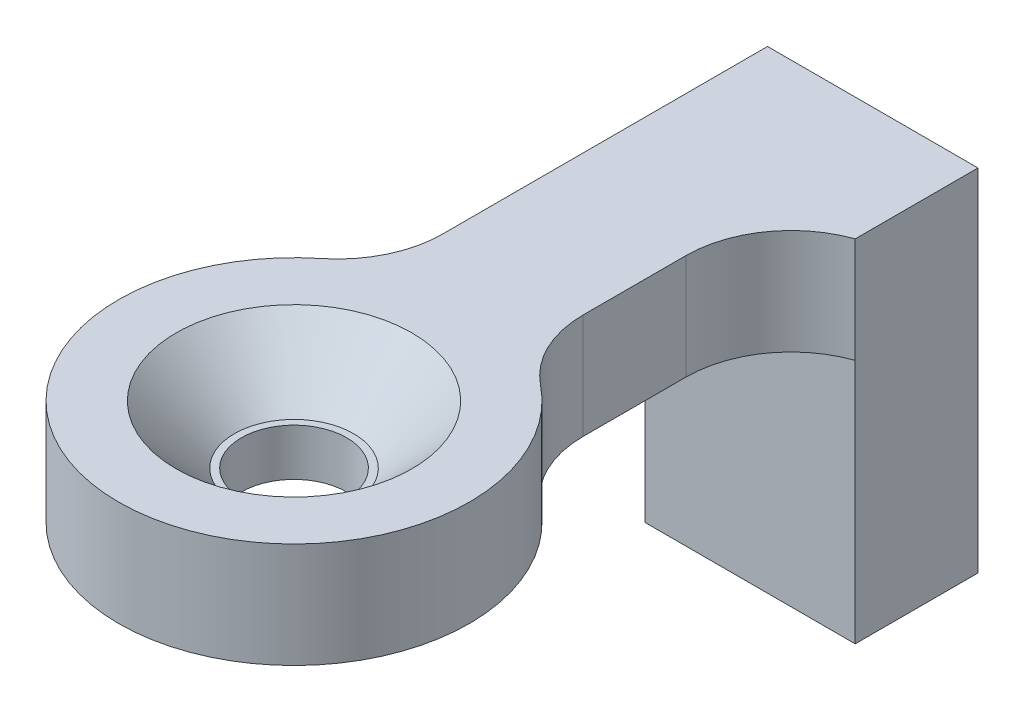
from build123d import *

# Parameters (mm, degrees)
CROQUIS1_W              = 4
CROQUIS1_H              = 14
CROQUIS1_R              = 1.5
SALIENTE_EXTRUIR1_DEPTH = 3
CROQUIS2_W              = 6
CROQUIS2_H              = 3.5
SALIENTE_EXTRUIR2_DEPTH = 10
SALIENTE_EXTRUIR3_START = -3
CROQUIS3_R              = 5
CROQUIS3_R_2            = 1.5
SALIENTE_EXTRUIR3_DEPTH = 3
REDONDEO1_R             = 3


# Read off the part's stored shape, not the designer's step: TaladroAvanzado1
with BuildPart() as part:
    # Croquis1 → Saliente-Extruir1 (new body)
    with BuildSketch(Plane(origin=(0, 0, 0), x_dir=(1, 0, 0), z_dir=(0, 1, 0))):
        with Locations((2, 7)):
            Rectangle(CROQUIS1_W, CROQUIS1_H)
        with Locations(Location((2, 2, 0), (0, 0, 270))):
            Circle(CROQUIS1_R, mode=Mode.SUBTRACT)
    extrude(amount=SALIENTE_EXTRUIR1_DEPTH)

    # Croquis2 → Saliente-Extruir2 (add)
    with BuildSketch(Plane(origin=(0, 3, 0), x_dir=(1, 0, 0), z_dir=(0, 1, 0))):
        with Locations((3, 15.75)):
            Rectangle(CROQUIS2_W, CROQUIS2_H)
    extrude(amount=-SALIENTE_EXTRUIR2_DEPTH)

    # Croquis3 → Saliente-Extruir3 (add)
    with BuildSketch(Plane(origin=(0, 3, 0), x_dir=(1, 0, 0), z_dir=(0, 1, 0)).offset(SALIENTE_EXTRUIR3_START)):
        with Locations((2, 2)):
            Circle(CROQUIS3_R)
        with Locations(Location((2, 2, 0), (0, 0, 270))):
            Circle(CROQUIS3_R_2, mode=Mode.SUBTRACT)
    extrude(amount=SALIENTE_EXTRUIR3_DEPTH)

    # TaladroAvanzado1 outline → TaladroAvanzado1 (revolve, cut)
    with BuildSketch(Plane(origin=(2, 0, -2), x_dir=(1, 0, 0), z_dir=(0, 0, 1))):
        Polygon((1.5, 1.34), (1.7, 1.34), (3.36, 3), (1.5, 3), align=None)
    revolve(axis=Axis((2, 0, -2), (0, 1, 0)), mode=Mode.SUBTRACT)

    # Redondeo1
    # the kernel refuses this fillet: 3 mm, written as the material it adds along each edge
    with BuildSketch(Plane(origin=(4, 0, -14), x_dir=(1, 0, 0), z_dir=(0, 1, 0))) as redondeo1_piece_1:
        with BuildLine():
            CenterArc((3, -2.828427125), REDONDEO1_R, 109.471220634, 70.528779366)
            Line((0, -2.828427125), (-0.06, -2.828427125))
            Line((-0.06, -2.828427125), (-0.06, 0))
            Line((-0.06, 0), (0, 0.06))
            ThreePointArc((0, 0.06), (1, 0.06), (1.98, 0.056568542))
            Line((1.98, 0.056568542), (2, 0))
        make_face()
    extrude(amount=3)
    with BuildSketch(Plane(origin=(4, 3, -6.582575695), x_dir=(0, 0, -1), z_dir=(0, -1, 0))) as redondeo1_piece_2:
        with BuildLine():
            CenterArc((1.662422303, 3), REDONDEO1_R, 218.682187453, 51.317812547)
            Line((-0.679451946, 1.125), (-0.726289431, 1.0875))
            ThreePointArc((-0.726289431, 1.0875), (-0.353961086, 0.5539026), (-0.054990908, -0.024))
            Line((-0.054990908, -0.024), (0, -0.06))
            Line((0, -0.06), (1.662422303, -0.06))
            Line((1.662422303, -0.06), (1.662422303, 0))
        make_face()
    extrude(amount=3)
    with BuildSketch(Plane(origin=(0, 3, -6.582575695), x_dir=(0, 0, -1), z_dir=(0, -1, 0))) as redondeo1_piece_3:
        with BuildLine():
            CenterArc((1.662422303, -3), REDONDEO1_R, 90, 51.317812547)
            Line((-0.679451946, -1.125), (-0.726289431, -1.0875))
            ThreePointArc((-0.726289431, -1.0875), (-0.353961086, -0.5539026), (-0.054990908, 0.024))
            Line((-0.054990908, 0.024), (0, 0.06))
            Line((0, 0.06), (1.662422303, 0.06))
            Line((1.662422303, 0.06), (1.662422303, 0))
        make_face()
    extrude(amount=3)


solid = part.part
